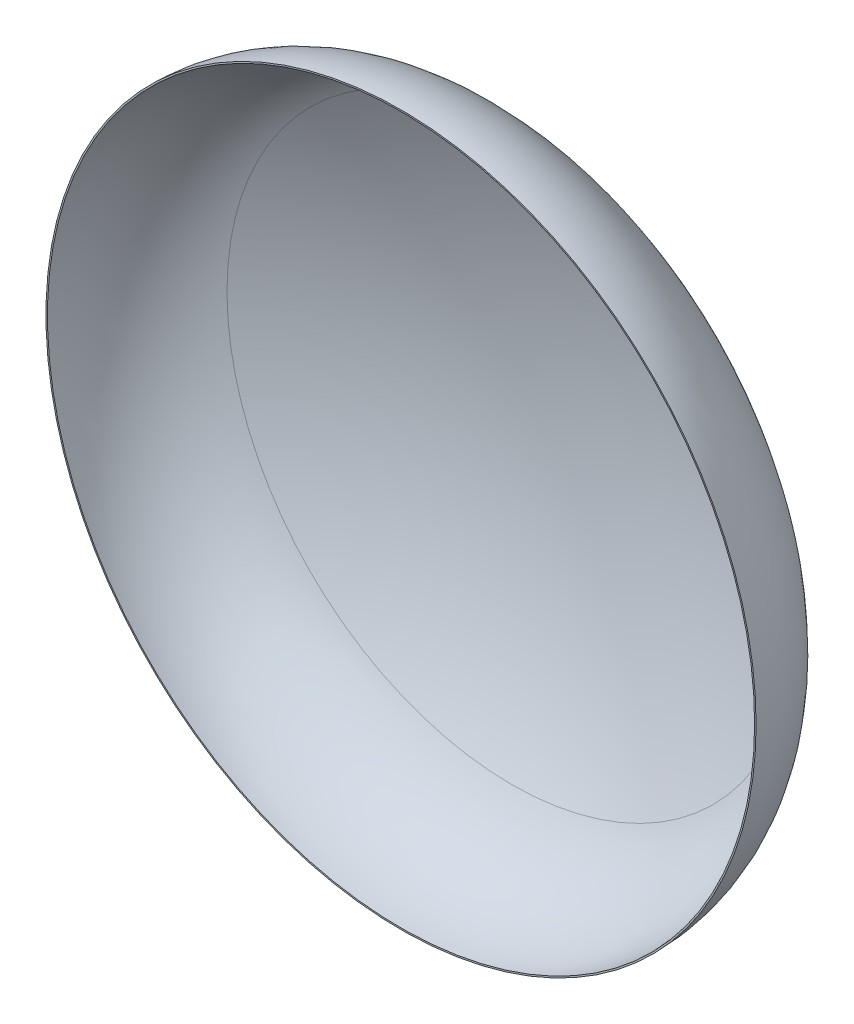
from build123d import *

# Parameters (mm, degrees)
SCALE1_SCALE = 25.4


with BuildPart() as part:
    # Sketch1 → Revolve-Thin2 (revolve)
    with BuildSketch(Plane(origin=(0, 0, 0), x_dir=(0, 0, -1), z_dir=(1, 0, 0))):
        with BuildLine():
            ThreePointArc((19.195710728, 0), (18.051167415, 9.914732181), (14.677744268, 19.307916406))
            ThreePointArc((14.677744268, 19.307916406), (11.557742765, 22.742167977), (7.095710728, 24.014474279))
            Line((7.095710728, 24.014474279), (7.095710728, 23.914474279))
            ThreePointArc((7.095710728, 23.914474279), (11.505002693, 22.657206311), (14.588126579, 19.263546712))
            ThreePointArc((14.588126579, 19.263546712), (17.953797581, 9.891948074), (19.095710728, 0))
            Line((19.095710728, 0), (19.095610728, 0))
            ThreePointArc((19.095610728, 0), (17.953700211, 9.891925289), (14.588036962, 19.263502342))
            ThreePointArc((14.588036962, 19.263502342), (11.504907472, 22.657147719), (7.095610728, 23.914374278))
            Line((7.095610728, 23.914374278), (7.095610728, 24.014574278))
            ThreePointArc((7.095610728, 24.014574278), (11.557753024, 22.742279309), (14.677833886, 19.307960776))
            ThreePointArc((14.677833886, 19.307960776), (18.051264784, 9.914754965), (19.195810728, 0))
            Line((19.195810728, 0), (19.195710728, 0))
        make_face()
    revolve(axis=Axis((0, 0, -7.095710728), (0, 0, 1)))


with BuildPart() as part_1:
    # Scale1: scaled about (0, 1e-09, -13.921880613)
    add(part.part.scale(SCALE1_SCALE).moved(Location((0, -2.4e-08, 339.693886957))))


solid = part_1.part
